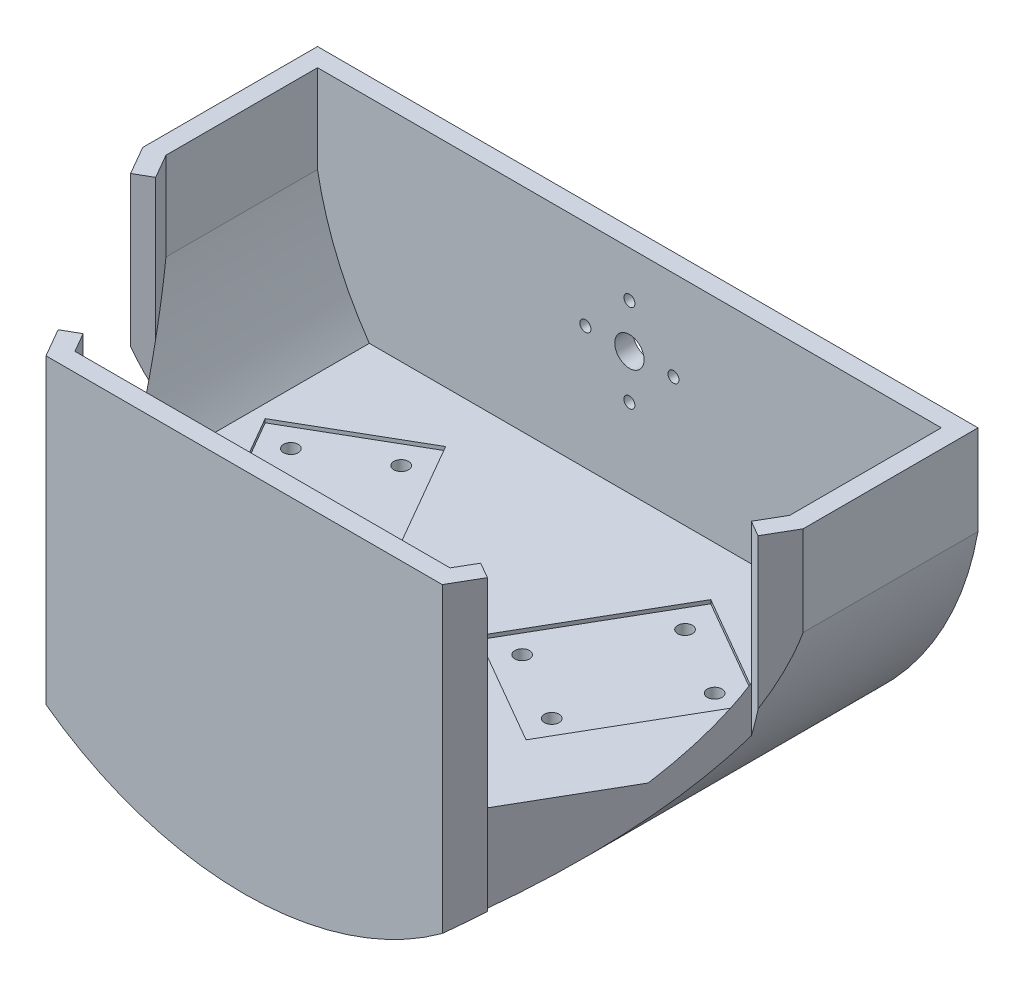
from build123d import *

# Parameters (mm, degrees)
BOSS_EXTRUDE1_DEPTH      = 50
BOSS_EXTRUDE1_DEPTH_BACK = 50
CUT_EXTRUDE1_DEPTH       = 151.665191733
SHELL1_T                 = -5
CUT_EXTRUDE2_START       = -5
CUT_EXTRUDE2_OUTLINE_W   = 54
CUT_EXTRUDE2_OUTLINE_H   = 87
CUT_EXTRUDE2_DEPTH       = 5
BOSS_EXTRUDE3_REACH      = 149.054
SKETCH6_R                = 2
CUT_EXTRUDE4_DEPTH       = 121.370262108
SKETCH6_4_R              = 2
CUT_EXTRUDE5_DEPTH       = 1
CUT_EXTRUDE6_DEPTH       = 31
SKETCH11_R               = 4
SKETCH11_R_2             = 1.5
CUT_EXTRUDE7_DEPTH       = 31
SKETCH12_R               = 4.5
CUT_EXTRUDE8_DEPTH       = 28


# Read off the part's stored shape, not the designer's step: Cut-Extrude2
with BuildPart() as part:
    # Sketch2 → Boss-Extrude1 (new, two sides: drawn at the far end of the back side and taken through both)
    with BuildSketch(Plane(origin=(0, 0, 0), x_dir=(1, 0, 0), z_dir=(0, 1, 0)).offset(-BOSS_EXTRUDE1_DEPTH_BACK)):
        Polygon((-90, 7.353829072), (-54, -55), (54, -55), (90, 7.353829072), (90, 55), (-90, 55), align=None)
    extrude(amount=BOSS_EXTRUDE1_DEPTH + BOSS_EXTRUDE1_DEPTH_BACK)

    # Sketch3 → Cut-Extrude1 (cut, through all)
    with BuildSketch(Plane(origin=(0, 0, -55), x_dir=(-1, 0, 0), z_dir=(0, 0, -1))):
        with BuildLine():
            ThreePointArc((4.5e-08, -50), (-58.743320462, -28.619184987), (-90, 25.518943344))
            Line((-90, 25.518943344), (-90, -50))
            Line((-90, -50), (4.5e-08, -50))
        make_face()
        with BuildLine():
            ThreePointArc((90, 25.518943344), (58.743320497, -28.619184957), (4.5e-08, -50))
            Line((4.5e-08, -50), (90, -50))
            Line((90, -50), (90, 25.518943344))
        make_face()
    extrude(amount=-CUT_EXTRUDE1_DEPTH, mode=Mode.SUBTRACT)

    # Shell1
    shell1_openings = [part.faces().sort_by_distance(p)[0] for p in [
        (0, 50, -4.375017638),
    ]]
    offset(amount=SHELL1_T, openings=shell1_openings, kind=Kind.INTERSECTION)

    # Cut-Extrude2 outline → Cut-Extrude2 (cut)
    with BuildSketch(Plane(origin=(-64.315698604, 0, 37.132685902), x_dir=(0.500000000000001, 0, 0.8660254037844382), z_dir=(-0.866025403784438, 0, 0.5000000000000009)).offset(CUT_EXTRUDE2_START)):
        with Locations((-15.368602792, 6.5)):
            Rectangle(CUT_EXTRUDE2_OUTLINE_W, CUT_EXTRUDE2_OUTLINE_H)
    cut_extrude2 = extrude(amount=CUT_EXTRUDE2_DEPTH, mode=Mode.SUBTRACT)

    # Mirror1: Cut-Extrude2 across plane
    add(cut_extrude2.mirror(Plane(origin=(0, 0, 0), x_dir=(0, 0, 1), z_dir=(1, 0, 0))), mode=Mode.SUBTRACT)

    # Boss-Extrude3: up to this face of the body (flat: up to its plane)
    boss_extrude3_end = Plane(part.part.faces().sort_by_distance((0, 5.038192354, 50))[0])
    # Sketch8 → Boss-Extrude3 (add, up to the picked face)
    with BuildSketch(Plane.XY.offset(-50), mode=Mode.PRIVATE) as boss_extrude3_sk1:
        with BuildLine():
            Line((76.893599213, -8), (-76.893599213, -8))
            ThreePointArc((-76.893599213, -8), (0, -50), (76.893599213, -8))
        make_face()
    boss_extrude3_tool1 = split(extrude(boss_extrude3_sk1.sketch, amount=BOSS_EXTRUDE3_REACH, mode=Mode.PRIVATE), bisect_by=boss_extrude3_end, keep=Keep.BOTH, mode=Mode.PRIVATE)
    add(boss_extrude3_tool1.solids().sort_by(Axis((0, -25.182235, -50), (0, 0, 1)))[0])

    # Sketch6 → Cut-Extrude4 (cut, through all)
    with BuildSketch(Plane(origin=(0, -8, 0), x_dir=(1, 0, 0), z_dir=(0, 1, 0))):
        with Locations(Location((-57.742314098, 15.481878155, 0), (0, 0, 270))):
            Circle(SKETCH6_R)
        with Locations(Location((-38.689755215, 26.481878155, 0), (0, 0, 270))):
            Circle(SKETCH6_R)
        with Locations(Location((-41.492314098, -12.663947468, 0), (0, 0, 270))):
            Circle(SKETCH6_R)
        with Locations(Location((-22.439755215, -1.663947468, 0), (0, 0, 270))):
            Circle(SKETCH6_R)
        with Locations(Location((22.439755215, -1.663947468, 0), (0, 0, 270))):
            Circle(SKETCH6_R)
        with Locations(Location((41.492314098, -12.663947468, 0), (0, 0, 270))):
            Circle(SKETCH6_R)
        with Locations(Location((38.689755215, 26.481878155, 0), (0, 0, 270))):
            Circle(SKETCH6_R)
        with Locations(Location((57.742314098, 15.481878155, 0), (0, 0, 270))):
            Circle(SKETCH6_R)
    extrude(amount=-CUT_EXTRUDE4_DEPTH, mode=Mode.SUBTRACT)

    # Sketch6<4> → Cut-Extrude5 (cut)
    # profile 1 of 2: a face of its own
    with BuildSketch(Plane(origin=(0, -8, 0), x_dir=(1, 0, 0), z_dir=(0, 1, 0))):
        Polygon((36.127577388, 36.044055982), (67.304491924, 18.044055982), (44.054491924, -22.226125294), (12.877577388, -4.226125294), align=None)
        with Locations(Location((38.689755215, 26.481878155, 0), (0, 0, 270))):
            Circle(SKETCH6_4_R, mode=Mode.SUBTRACT)
        with Locations(Location((22.439755215, -1.663947468, 0), (0, 0, 270))):
            Circle(SKETCH6_4_R, mode=Mode.SUBTRACT)
        with Locations(Location((41.492314098, -12.663947468, 0), (0, 0, 270))):
            Circle(SKETCH6_4_R, mode=Mode.SUBTRACT)
        with Locations(Location((57.742314098, 15.481878155, 0), (0, 0, 270))):
            Circle(SKETCH6_4_R, mode=Mode.SUBTRACT)
    # profile 2 of 2: a face of its own
    with BuildSketch(Plane(origin=(0, -8, 0), x_dir=(1, 0, 0), z_dir=(0, 1, 0))):
        Polygon((-36.127577388, 36.044055982), (-12.877577388, -4.226125294), (-44.054491924, -22.226125294), (-67.304491924, 18.044055982), align=None)
    extrude(amount=-CUT_EXTRUDE5_DEPTH, mode=Mode.SUBTRACT)

    # Sketch10 → Cut-Extrude6 (cut)
    with BuildSketch(Plane(origin=(0, -8, 0), x_dir=(1, 0, 0), z_dir=(0, 1, 0))):
        Polygon((-76.893599213, -5.347122994), (-54.169872981, -44.705771366), (-58.5, -47.205771366), (-56.886751346, -50), (-76.893599213, -50), align=None)
    cut_extrude6 = extrude(amount=-CUT_EXTRUDE6_DEPTH, mode=Mode.SUBTRACT)

    # Mirror2: Cut-Extrude6 across plane
    add(cut_extrude6.mirror(Plane(origin=(0, 0, 0), x_dir=(0, 0, 1), z_dir=(1, 0, 0))), mode=Mode.SUBTRACT)

    # Sketch11 → Cut-Extrude7 (cut)
    with BuildSketch(Plane(origin=(0, 0, -55), x_dir=(-1, 0, 0), z_dir=(0, 0, -1))):
        with Locations((0, 25.54)):
            Circle(SKETCH11_R)
        with Locations((-12, 25.54)):
            Circle(SKETCH11_R_2)
        with Locations((0, 37.54)):
            Circle(SKETCH11_R_2)
        with Locations((12, 25.54)):
            Circle(SKETCH11_R_2)
        with Locations((0, 13.54)):
            Circle(SKETCH11_R_2)
    extrude(amount=-CUT_EXTRUDE7_DEPTH, mode=Mode.SUBTRACT)

    # Sketch12 → Cut-Extrude8 (cut)
    with BuildSketch(Plane(origin=(0, -50, 0), x_dir=(1, 0, 0), z_dir=(0, 1, 0))):
        with Locations(Location((-41.492314098, -12.663947468, 0), (0, 0, 90))):
            Circle(SKETCH12_R)
        with Locations(Location((-57.742314098, 15.481878155, 0), (0, 0, 90))):
            Circle(SKETCH12_R)
        with Locations(Location((-38.689755215, 26.481878155, 0), (0, 0, 90))):
            Circle(SKETCH12_R)
        with Locations(Location((57.742314098, 15.481878155, 0), (0, 0, 90))):
            Circle(SKETCH12_R)
        with Locations(Location((-22.439755215, -1.663947468, 0), (0, 0, 90))):
            Circle(SKETCH12_R)
        with Locations(Location((38.689755215, 26.481878155, 0), (0, 0, 90))):
            Circle(SKETCH12_R)
        with Locations(Location((41.492314098, -12.663947468, 0), (0, 0, 90))):
            Circle(SKETCH12_R)
        with Locations(Location((22.439755215, -1.663947468, 0), (0, 0, 90))):
            Circle(SKETCH12_R)
    extrude(amount=CUT_EXTRUDE8_DEPTH, mode=Mode.SUBTRACT)


solid = part.part
